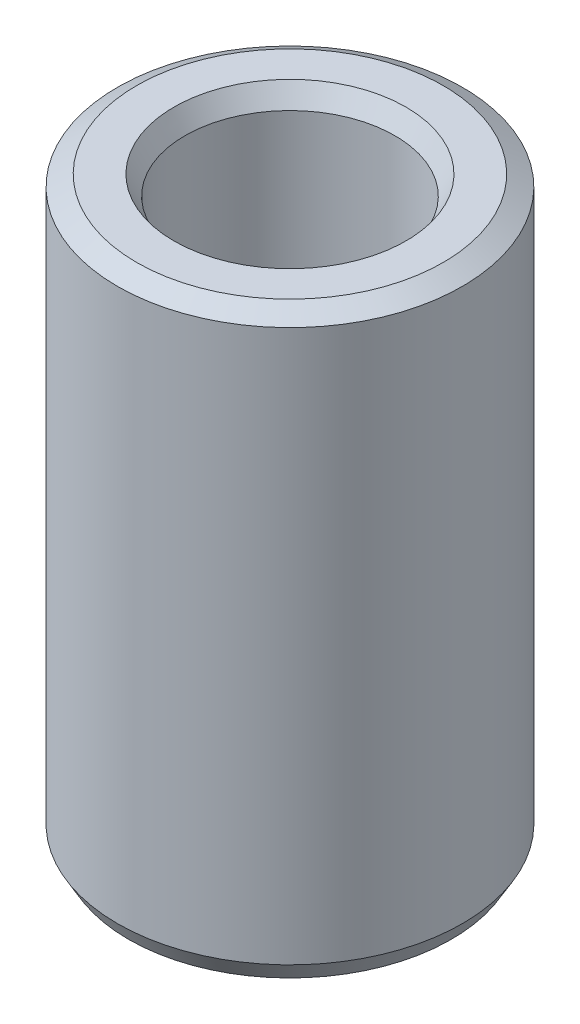
from build123d import *
from OCP.BRepFilletAPI import BRepFilletAPI_MakeChamfer

# Parameters (mm, degrees)
SKETCH1_R           = 42.5
BOSS_EXTRUDE1_DEPTH = 143.456491823
SKETCH2_R           = 25.854167134
CUT_EXTRUDE1_DEPTH  = 156.538628791
CHAMFER1_SIZE       = 2.732016064
CHAMFER1_SIZE2      = 4.73199063


with BuildPart() as part:
    # Sketch1 → Boss-Extrude1 (new body)
    with BuildSketch(Plane(origin=(0, 0, 0), x_dir=(1, 0, 0), z_dir=(0, 1, 0))):
        Circle(SKETCH1_R)
    extrude(amount=BOSS_EXTRUDE1_DEPTH)

    # Sketch2 → Cut-Extrude1 (cut, through all)
    with BuildSketch(Plane(origin=(0, 0, 0), x_dir=(1, 0, 0), z_dir=(0, 1, 0))):
        Circle(SKETCH2_R)
    extrude(amount=CUT_EXTRUDE1_DEPTH, mode=Mode.SUBTRACT)

    # Chamfer1: one chamfer whose edges measure the first distance from different faces: ONE call of the kernel's chamfer builder (chamfer() names one face for all edges)
    chamfer1_edges_1 = [part.edges().sort_by_distance(p)[0] for p in [
        (-25.854167134, 143.456491823, 0),
    ]]
    chamfer1_side_1 = [part.faces().sort_by_distance(p)[0] for p in [
        (-41.297918472, 143.456491823, 0),
    ]]
    chamfer1_edges_2 = [part.edges().sort_by_distance(p)[0] for p in [
        (-25.854167134, 0, 0),
    ]]
    chamfer1_side_2 = [part.faces().sort_by_distance(p)[0] for p in [
        (-25.854167134, 71.728245911, 0),
    ]]
    chamfer1_edges_3 = [part.edges().sort_by_distance(p)[0] for p in [
        (-42.5, 0, 0),
    ]]
    chamfer1_side_3 = [part.faces().sort_by_distance(p)[0] for p in [
        (-41.297918472, 0, 0),
    ]]
    chamfer1_edges_4 = [part.edges().sort_by_distance(p)[0] for p in [
        (-42.5, 143.456491823, 0),
    ]]
    chamfer1_side_4 = [part.faces().sort_by_distance(p)[0] for p in [
        (-42.5, 71.728245911, 0),
    ]]
    chamfer1 = BRepFilletAPI_MakeChamfer(part.part.solid().wrapped)
    for e in chamfer1_edges_1:
        chamfer1.Add(CHAMFER1_SIZE, CHAMFER1_SIZE2, e.wrapped, chamfer1_side_1[0].wrapped)  # the first distance lies on this face
    for e in chamfer1_edges_2:
        chamfer1.Add(CHAMFER1_SIZE, CHAMFER1_SIZE2, e.wrapped, chamfer1_side_2[0].wrapped)  # the first distance lies on this face
    for e in chamfer1_edges_3:
        chamfer1.Add(CHAMFER1_SIZE, CHAMFER1_SIZE2, e.wrapped, chamfer1_side_3[0].wrapped)  # the first distance lies on this face
    for e in chamfer1_edges_4:
        chamfer1.Add(CHAMFER1_SIZE, CHAMFER1_SIZE2, e.wrapped, chamfer1_side_4[0].wrapped)  # the first distance lies on this face
    add(Compound.cast(chamfer1.Shape()), mode=Mode.REPLACE)


solid = part.part
